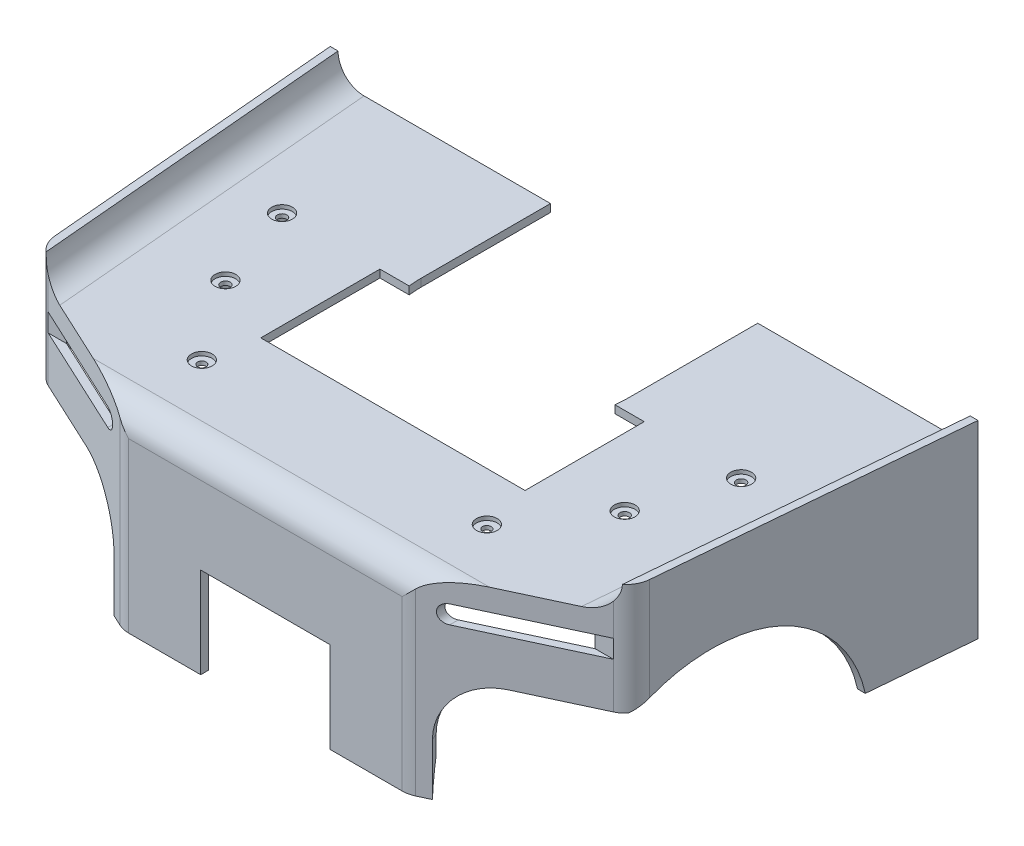
from build123d import *

# Parameters (mm, degrees)
SALIENTE_EXTRUIR1_DEPTH = 125
CORTAR_EXTRUIR1_REACH   = 170.745
CORTAR_EXTRUIR2_DEPTH   = 10
VACIADO1_START          = -69
VACIADO1_DEPTH          = 72.5
CORTAR_EXTRUIR4_DEPTH   = 32
CROQUIS6_W              = 50
CROQUIS6_H              = 35
CORTAR_EXTRUIR5_DEPTH   = 32
CORTAR_EXTRUIR6_DEPTH   = 32
REDONDEO1_R             = 10
CORTAR_EXTRUIR8_REACH   = 165.936
CROQUIS9_R              = 1.825
CROQUIS10_R             = 4
CORTAR_EXTRUIR9_DEPTH   = 1.5
CORTAR_EXTRUIR10_DEPTH  = 25.21008
CROQUIS12_R             = 1.65
CORTAR_EXTRUIR11_DEPTH  = 3
CROQUIS13_R             = 4
CORTAR_EXTRUIR12_DEPTH  = 1.5
CROQUIS16_W             = 102
CROQUIS16_H             = 46
CORTAR_EXTRUIR13_DEPTH  = 164.935963199
SALIENTE_EXTRUIR2_DEPTH = 40
REDONDEO2_R             = 50


with BuildPart() as part:
    # Croquis2 → Saliente-Extruir1 (new, symmetric)
    with BuildSketch(Plane(origin=(0, 0, 0), x_dir=(0, 0, -1), z_dir=(1, 0, 0))):
        with BuildLine():
            Line((-75, -16.5), (-75, -68.5))
            Line((-75, -68.5), (-72, -68.5))
            ThreePointArc((-72, -68.5), (-53.577843382, -31.453133216), (-15, -16.5))
            Line((-15, -16.5), (75, -16.5))
            Line((75, -16.5), (75, 16.5))
            Line((75, 16.5), (-75, 16.5))
            Line((-75, 16.5), (-75, -16.5))
        make_face()
    extrude(amount=SALIENTE_EXTRUIR1_DEPTH, both=True)

    # Croquis3 → Cortar-Extruir1 (cut, up to next)
    with BuildSketch(Plane(origin=(0, 16.5, 0), x_dir=(1, 0, 0), z_dir=(0, 1, 0)), mode=Mode.PRIVATE) as cortar_extruir1_sk1:
        Polygon((-125, 75), (-114.295768213, -47.349929186), (-55, -75), (-125, -75), align=None)
    cortar_extruir1_tool1 = extrude(cortar_extruir1_sk1.sketch, amount=-CORTAR_EXTRUIR1_REACH, mode=Mode.PRIVATE) & part.part
    # Croquis3 → Cortar-Extruir1 (cut, up to next)
    with BuildSketch(Plane(origin=(0, 16.5, 0), x_dir=(1, 0, 0), z_dir=(0, 1, 0)), mode=Mode.PRIVATE) as cortar_extruir1_sk2:
        Polygon((114.295768213, -47.349929186), (55, -75), (125, -75), (125, 75), align=None)
    cortar_extruir1_tool2 = extrude(cortar_extruir1_sk2.sketch, amount=-CORTAR_EXTRUIR1_REACH, mode=Mode.PRIVATE) & part.part
    add(cortar_extruir1_tool1.solids().sort_by_distance((-121.29688, 16.5, -13.680767))[0], mode=Mode.SUBTRACT)
    add(cortar_extruir1_tool2.solids().sort_by_distance((85.347442, 16.5, 62.675171))[0], mode=Mode.SUBTRACT)

    # Croquis4 → Cortar-Extruir2 (cut)
    with BuildSketch(Plane(origin=(0, 16.5, 0), x_dir=(1, 0, 0), z_dir=(0, 1, 0))):
        Polygon((-108.865240958, -75), (-121.988540487, 75), (121.988540487, 75), (108.865240958, -75), align=None)
    extrude(amount=-CORTAR_EXTRUIR2_DEPTH, mode=Mode.SUBTRACT)

    # Vaciado1: read off the stored shape, not the designer's step
    # Vaciado1 outline → Vaciado1 (cut)
    with BuildSketch(Plane(origin=(0, 0, 0), x_dir=(1, 0, 0), z_dir=(0, 1, 0)).offset(VACIADO1_START)):
        Polygon((-121.988540487, 75), (-111.458142293, -45.363002127), (-54.334916012, -72), (54.334916012, -72), (111.458142293, -45.363002127), (121.988540487, 75), align=None)
    extrude(amount=VACIADO1_DEPTH, mode=Mode.SUBTRACT)

    # Croquis5 → Cortar-Extruir4 (cut)
    with BuildSketch(Plane(origin=(0, 6.5, 0), x_dir=(1, 0, 0), z_dir=(0, 1, 0))):
        with BuildLine():
            Line((-40, 25), (-40, 75))
            Line((-40, 75), (40, 75))
            Line((40, 75), (40, 25))
            ThreePointArc((40, 25), (0, -15), (-40, 25))
        make_face()
    extrude(amount=-CORTAR_EXTRUIR4_DEPTH, mode=Mode.SUBTRACT)

    # Croquis6 → Cortar-Extruir5 (cut)
    with BuildSketch(Plane.XY.offset(75)):
        with Locations((0, -51)):
            Rectangle(CROQUIS6_W, CROQUIS6_H)
    extrude(amount=-CORTAR_EXTRUIR5_DEPTH, mode=Mode.SUBTRACT)

    # Croquis7 → Cortar-Extruir6 (cut)
    with BuildSketch(Plane(origin=(38.550007351, 0, 82.670757549), x_dir=(0.9063077870366526, 0, -0.4226182617406938), z_dir=(0.42261826174069383, 0, 0.9063077870366527))):
        with BuildLine():
            Line((25.249163406, -68.5), (25.249163406, -48.5))
            ThreePointArc((25.249163406, -48.5), (31.687511452, -32.956452829), (47.231058623, -26.518104783))
            Line((47.231058623, -26.518104783), (83.576199991, -26.518104783))
            add(Edge.make_bspline(
                [(83.576199991, -26.518104783), (31.075327753, -41.718019878), (25.249163406, -68.5)],
                knots=[5.313015178, 5.313015178, 5.313015178, 6.191506455, 6.191506455, 6.191506455], degree=2, weights=[1, 0.905072718, 1]))
        make_face()
    cortar_extruir6 = extrude(amount=-CORTAR_EXTRUIR6_DEPTH, mode=Mode.SUBTRACT)

    # Simetría1: Cortar-Extruir6 across plane
    add(cortar_extruir6.mirror(Plane(origin=(0, 0, 0), x_dir=(0, 0, 1), z_dir=(1, 0, 0))), mode=Mode.SUBTRACT)

    # Redondeo1
    # the kernel refuses this fillet: 10 mm, written as the material it adds along each edge
    with BuildSketch(Plane(origin=(-54.334916012, -74.042366566, 72), x_dir=(1, 0, 0), z_dir=(0, 1, 0))) as redondeo1_piece_1_section:
        with BuildLine():
            CenterArc((REDONDEO1_R * 0.22169466264, REDONDEO1_R), REDONDEO1_R, 245, 25)
            Line((-REDONDEO1_R * 0.200923599096, REDONDEO1_R * 0.0936922129612), (0, 0))
            Line((0, 0), (REDONDEO1_R * 0.22169466264, 0))
        make_face()
    redondeo1_piece_1 = extrude(amount=77.542366566, mode=Mode.PRIVATE)
    redondeo1_piece_1 = redondeo1_piece_1 - Plane(origin=(-54.334916012, -73.740384615, 15), x_dir=(0, 0.09155047875020969, 0.9958004367545775), z_dir=(1, 0, 0)) * Cylinder(57.240384615, 164, mode=Mode.PRIVATE)
    add(redondeo1_piece_1)
    with BuildSketch(Plane(origin=(-79.334916012, 3.5, 72), x_dir=(0, -1, 0), z_dir=(1, 0, 0))) as redondeo1_piece_2_section:
        with BuildLine():
            CenterArc((REDONDEO1_R, REDONDEO1_R), REDONDEO1_R, 180, 90)
            Line((0, REDONDEO1_R), (0, 0))
            Line((0, 0), (REDONDEO1_R, 0))
        make_face()
    redondeo1_piece_2 = extrude(amount=158.669832024, mode=Mode.PRIVATE)
    redondeo1_piece_2 = split(redondeo1_piece_2, bisect_by=Plane(origin=(-55.460655907, 3.5, 123.198516017), z_dir=(-0.4226182617361229, 0, -0.9063077870387841)), keep=Keep.TOP, mode=Mode.PRIVATE)
    redondeo1_piece_2 = split(redondeo1_piece_2, bisect_by=Plane(origin=(-74.869761133, 3.5, 62.424444461), z_dir=(0.4226182617361229, 0, -0.9063077870387841)), keep=Keep.TOP, mode=Mode.PRIVATE)
    add(redondeo1_piece_2)
    with BuildSketch(Plane(origin=(54.334916012, -74.042366566, 72), x_dir=(-1, 0, 0), z_dir=(0, 1, 0))) as redondeo1_piece_3_section:
        with BuildLine():
            CenterArc((REDONDEO1_R * 0.22169466264, -REDONDEO1_R), REDONDEO1_R, 90, 25)
            Line((-REDONDEO1_R * 0.200923599096, -REDONDEO1_R * 0.0936922129612), (0, 0))
            Line((0, 0), (REDONDEO1_R * 0.22169466264, 0))
        make_face()
    redondeo1_piece_3 = extrude(amount=77.542366566, mode=Mode.PRIVATE)
    redondeo1_piece_3 = redondeo1_piece_3 - Plane(origin=(54.334916012, -73.740384615, 15), x_dir=(0, 0.09155047875020969, 0.9958004367545775), z_dir=(1, 0, 0)) * Cylinder(57.240384615, 164, mode=Mode.PRIVATE)
    add(redondeo1_piece_3)
    with BuildSketch(Plane(origin=(124.167434056, 6.5, -99.904867452), x_dir=(-0.996194698091746, 0, -0.0871557427476514), z_dir=(-0.0871557427476514, 0, 0.9961946980917462))) as redondeo1_piece_4_section:
        with BuildLine():
            CenterArc((REDONDEO1_R, -REDONDEO1_R), REDONDEO1_R, 90, 90)
            Line((0, -REDONDEO1_R), (0, 0))
            Line((0, 0), (REDONDEO1_R, 0))
        make_face()
    redondeo1_piece_4 = extrude(amount=174.286870856, mode=Mode.PRIVATE)
    redondeo1_piece_4 = split(redondeo1_piece_4, bisect_by=Plane(origin=(178.806152724, 6.5, 17.268242858), z_dir=(-0.42261826174069395, 0, -0.9063077870366526)), keep=Keep.TOP, mode=Mode.PRIVATE)
    redondeo1_piece_4 = split(redondeo1_piece_4, bisect_by=Plane(origin=(124.167434056, 6.5, -75), z_dir=(0, 0, 1)), keep=Keep.TOP, mode=Mode.PRIVATE)
    add(redondeo1_piece_4)
    with BuildSketch(Plane(origin=(-108.977332375, 6.5, 73.718789241), x_dir=(0.996194698091746, 0, -0.08715574274765167), z_dir=(-0.08715574274765168, 0, -0.9961946980917462))) as redondeo1_piece_5_section:
        with BuildLine():
            CenterArc((REDONDEO1_R, -REDONDEO1_R), REDONDEO1_R, 90, 90)
            Line((0, -REDONDEO1_R), (0, 0))
            Line((0, 0), (REDONDEO1_R, 0))
        make_face()
    redondeo1_piece_5 = extrude(amount=174.286870856, mode=Mode.PRIVATE)
    redondeo1_piece_5 = split(redondeo1_piece_5, bisect_by=Plane(origin=(-99.827378606, 6.5, 54.096650061), z_dir=(0.42261826174069367, 0, -0.9063077870366527)), keep=Keep.TOP, mode=Mode.PRIVATE)
    redondeo1_piece_5 = split(redondeo1_piece_5, bisect_by=Plane(origin=(-108.977332375, 6.5, -75), z_dir=(0, 0, 1)), keep=Keep.TOP, mode=Mode.PRIVATE)
    add(redondeo1_piece_5)
    # the kernel refuses this fillet: 10 mm, written as the material it takes off along each edge
    with BuildSketch(Plane(origin=(114.295768213, 30.93375673, 47.349929186), x_dir=(0.08715574274765074, 0, -0.9961946980917462), z_dir=(0, -1, 0))) as redondeo1_2_piece_1:
        with BuildLine():
            CenterArc((REDONDEO1_R * 0.57735026919, -REDONDEO1_R), REDONDEO1_R, 90, 60)
            Line((-REDONDEO1_R * 0.288675134595, -REDONDEO1_R * 0.5), (0, 0))
            Line((0, 0), (REDONDEO1_R * 0.57735026919, 0))
        make_face()
    extrude(amount=71.885618242, mode=Mode.SUBTRACT)
    with BuildSketch(Plane(origin=(-114.295768213, 30.93375673, 47.349929186), x_dir=(-0.08715574274765074, 0, -0.9961946980917462), z_dir=(0, -1, 0))) as redondeo1_2_piece_2:
        with BuildLine():
            CenterArc((REDONDEO1_R * 0.57735026919, REDONDEO1_R), REDONDEO1_R, 210, 60)
            Line((-REDONDEO1_R * 0.288675134595, REDONDEO1_R * 0.5), (0, 0))
            Line((0, 0), (REDONDEO1_R * 0.57735026919, 0))
        make_face()
    extrude(amount=71.885618242, mode=Mode.SUBTRACT)
    with BuildSketch(Plane(origin=(55, 12.042366566, 75), x_dir=(-1, 0, 0), z_dir=(0, -1, 0))) as redondeo1_2_piece_3:
        with BuildLine():
            CenterArc((REDONDEO1_R * 0.221694662643, REDONDEO1_R), REDONDEO1_R, 245, 25)
            Line((-REDONDEO1_R * 0.200923599098, REDONDEO1_R * 0.0936922129633), (0, 0))
            Line((0, 0), (REDONDEO1_R * 0.221694662643, 0))
        make_face()
    extrude(amount=86.084733132, mode=Mode.SUBTRACT)
    with BuildSketch(Plane(origin=(-55, 12.042366566, 75), x_dir=(1, 0, 0), z_dir=(0, -1, 0))) as redondeo1_2_piece_4:
        with BuildLine():
            CenterArc((REDONDEO1_R * 0.221694662643, -REDONDEO1_R), REDONDEO1_R, 90, 25)
            Line((-REDONDEO1_R * 0.200923599098, -REDONDEO1_R * 0.0936922129633), (0, 0))
            Line((0, 0), (REDONDEO1_R * 0.221694662643, 0))
        make_face()
    extrude(amount=86.084733132, mode=Mode.SUBTRACT)
    with BuildSketch(Plane(origin=(80, 6.5, 75), x_dir=(0, -1, 0), z_dir=(-1, 0, 0))) as redondeo1_2_piece_5:
        with BuildLine():
            CenterArc((REDONDEO1_R, -REDONDEO1_R), REDONDEO1_R, 90, 90)
            Line((0, -REDONDEO1_R), (0, 0))
            Line((0, 0), (REDONDEO1_R, 0))
        make_face()
    extrude(amount=160, mode=Mode.SUBTRACT)

    # Croquis9 → Cortar-Extruir8 (cut, up to next)
    with BuildSketch(Plane(origin=(0, 6.5, 0), x_dir=(1, 0, 0), z_dir=(0, 1, 0)), mode=Mode.PRIVATE) as cortar_extruir8_sk1:
        with Locations(Location((88.585, 20, 0), (0, 0, 270))):
            Circle(CROQUIS9_R)
    cortar_extruir8_tool1 = extrude(cortar_extruir8_sk1.sketch, amount=-CORTAR_EXTRUIR8_REACH, mode=Mode.PRIVATE) & part.part
    # Croquis9 → Cortar-Extruir8 (cut, up to next)
    with BuildSketch(Plane(origin=(0, 6.5, 0), x_dir=(1, 0, 0), z_dir=(0, 1, 0)), mode=Mode.PRIVATE) as cortar_extruir8_sk2:
        with Locations(Location((77.049834861, -13.41, 0), (0, 0, 270))):
            Circle(CROQUIS9_R)
    cortar_extruir8_tool2 = extrude(cortar_extruir8_sk2.sketch, amount=-CORTAR_EXTRUIR8_REACH, mode=Mode.PRIVATE) & part.part
    # Croquis9 → Cortar-Extruir8 (cut, up to next)
    with BuildSketch(Plane(origin=(0, 6.5, 0), x_dir=(1, 0, 0), z_dir=(0, 1, 0)), mode=Mode.PRIVATE) as cortar_extruir8_sk3:
        with Locations(Location((-88.588016438, 20, 0), (0, 0, 270))):
            Circle(CROQUIS9_R)
    cortar_extruir8_tool3 = extrude(cortar_extruir8_sk3.sketch, amount=-CORTAR_EXTRUIR8_REACH, mode=Mode.PRIVATE) & part.part
    # Croquis9 → Cortar-Extruir8 (cut, up to next)
    with BuildSketch(Plane(origin=(0, 6.5, 0), x_dir=(1, 0, 0), z_dir=(0, 1, 0)), mode=Mode.PRIVATE) as cortar_extruir8_sk4:
        with Locations(Location((-77.052851299, -13.41, 0), (0, 0, 270))):
            Circle(CROQUIS9_R)
    cortar_extruir8_tool4 = extrude(cortar_extruir8_sk4.sketch, amount=-CORTAR_EXTRUIR8_REACH, mode=Mode.PRIVATE) & part.part
    add(cortar_extruir8_tool1.solids().sort_by_distance((88.585, 6.5, -20))[0], mode=Mode.SUBTRACT)
    add(cortar_extruir8_tool2.solids().sort_by_distance((77.049835, 6.5, 13.41))[0], mode=Mode.SUBTRACT)
    add(cortar_extruir8_tool3.solids().sort_by_distance((-88.588016, 6.5, -20))[0], mode=Mode.SUBTRACT)
    add(cortar_extruir8_tool4.solids().sort_by_distance((-77.052851, 6.5, 13.41))[0], mode=Mode.SUBTRACT)

    # Croquis10 → Cortar-Extruir9 (cut)
    with BuildSketch(Plane(origin=(0, 6.5, 0), x_dir=(1, 0, 0), z_dir=(0, 1, 0))):
        with Locations(Location((77.049834861, -13.41, 0), (0, 0, 270))):
            Circle(CROQUIS10_R)
        with Locations(Location((88.585, 20, 0), (0, 0, 270))):
            Circle(CROQUIS10_R)
        with Locations(Location((-88.588016438, 20, 0), (0, 0, 270))):
            Circle(CROQUIS10_R)
        with Locations(Location((-77.052851299, -13.41, 0), (0, 0, 270))):
            Circle(CROQUIS10_R)
    extrude(amount=-CORTAR_EXTRUIR9_DEPTH, mode=Mode.SUBTRACT)

    # Croquis11 → Cortar-Extruir10 (cut)
    with BuildSketch(Plane.XY.offset(75)):
        with BuildLine():
            Line((-69.006508219, -1.9), (-65.975419306, -1.9))
            ThreePointArc((-65.975419306, -1.9), (-62.475419306, -5.4), (-65.975419306, -8.9))
            Line((-65.975419306, -8.9), (-69.006508219, -8.9))
            Line((-69.006508219, -8.9), (-125, -8.9))
            Line((-125, -8.9), (-125, -1.9))
            Line((-125, -1.9), (-69.006508219, -1.9))
        make_face()
        with BuildLine():
            Line((69.006508219, -1.9), (65.975419306, -1.9))
            ThreePointArc((65.975419306, -1.9), (62.475419306, -5.4), (65.975419306, -8.9))
            Line((65.975419306, -8.9), (69.006508219, -8.9))
            Line((69.006508219, -8.9), (125, -8.9))
            Line((125, -8.9), (125, -1.9))
            Line((125, -1.9), (69.006508219, -1.9))
        make_face()
    extrude(amount=-CORTAR_EXTRUIR10_DEPTH, mode=Mode.SUBTRACT)

    # Croquis12 → Cortar-Extruir11 (cut)
    with BuildSketch(Plane.XZ.offset(-3.5)):
        with Locations(Location((55.003491781, 44.555, 0), (0, 0, 270))):
            Circle(CROQUIS12_R)
        with Locations(Location((-55.003491781, 44.555, 0), (0, 0, 270))):
            Circle(CROQUIS12_R)
    extrude(amount=-CORTAR_EXTRUIR11_DEPTH, mode=Mode.SUBTRACT)

    # Croquis13 → Cortar-Extruir12 (cut)
    with BuildSketch(Plane(origin=(0, 6.5, 0), x_dir=(1, 0, 0), z_dir=(0, 1, 0))):
        with Locations(Location((-55.003491781, -44.555, 0), (0, 0, 270))):
            Circle(CROQUIS13_R)
        with Locations(Location((55.003491781, -44.555, 0), (0, 0, 90))):
            Circle(CROQUIS13_R)
    extrude(amount=-CORTAR_EXTRUIR12_DEPTH, mode=Mode.SUBTRACT)

    # Croquis16 → Cortar-Extruir13 (cut, through all)
    with BuildSketch(Plane(origin=(0, 6.5, 0), x_dir=(1, 0, 0), z_dir=(0, 1, 0))):
        with Locations((0, -2.82000006)):
            Rectangle(CROQUIS16_W, CROQUIS16_H)
    extrude(amount=-CORTAR_EXTRUIR13_DEPTH, mode=Mode.SUBTRACT)

    # Croquis19 → Saliente-Extruir2 (add)
    with BuildSketch(Plane(origin=(0, -16.5, 0), x_dir=(-1, 0, 0), z_dir=(0, -1, 0))):
        Polygon((-125, 75), (-121.988540487, 75), (-118.488993946, 35), (-121.500453459, 35), align=None)
        Polygon((118.488993946, 35), (121.500453459, 35), (125, 75), (121.988540487, 75), align=None)
    extrude(amount=SALIENTE_EXTRUIR2_DEPTH)

    # Redondeo2
    # the kernel refuses this fillet: 50 mm, written as the material it adds along each edge
    with BuildSketch(Plane(origin=(-3.985493193, -16.5, -35), x_dir=(0, 0, 1), z_dir=(1, 0, 0))) as redondeo2_piece_1_section:
        with BuildLine():
            CenterArc((48.989794856, 50), REDONDEO2_R, 191.536959033, 78.463040967)
            Line((0, 40), (0, 0))
            Line((0, 0), (48.989794856, 0))
        make_face()
    redondeo2_piece_1 = extrude(amount=247.960433791, mode=Mode.PRIVATE)
    redondeo2_piece_1 = split(redondeo2_piece_1, bisect_by=Plane(origin=(120.547246711, -16.5, -24.104797021), z_dir=(-0.9961946980917461, 0, -0.08715574274765132)), keep=Keep.TOP, mode=Mode.PRIVATE)
    redondeo2_piece_1 = split(redondeo2_piece_1, bisect_by=Plane(origin=(117.558662617, -16.5, -24.366264249), z_dir=(0.9961946980917881, 0, 0.0871557427471721)), keep=Keep.TOP, mode=Mode.PRIVATE)
    add(redondeo2_piece_1)
    with BuildSketch(Plane(origin=(3.985493193, -16.5, -35), x_dir=(0, -1, 0), z_dir=(-1, 0, 0))) as redondeo2_piece_2_section:
        with BuildLine():
            CenterArc((50, 48.989794856), REDONDEO2_R, 180, 78.463040967)
            Line((0, 48.989794856), (0, 0))
            Line((0, 0), (40, 0))
        make_face()
    redondeo2_piece_2 = extrude(amount=247.960433791, mode=Mode.PRIVATE)
    redondeo2_piece_2 = split(redondeo2_piece_2, bisect_by=Plane(origin=(-117.558662617, -16.5, -24.366264249), z_dir=(-0.9961946980917881, 0, 0.0871557427471721)), keep=Keep.TOP, mode=Mode.PRIVATE)
    redondeo2_piece_2 = split(redondeo2_piece_2, bisect_by=Plane(origin=(-120.547246711, -16.5, -24.104797021), z_dir=(0.9961946980917461, 0, -0.08715574274765155)), keep=Keep.TOP, mode=Mode.PRIVATE)
    add(redondeo2_piece_2)


solid = part.part
